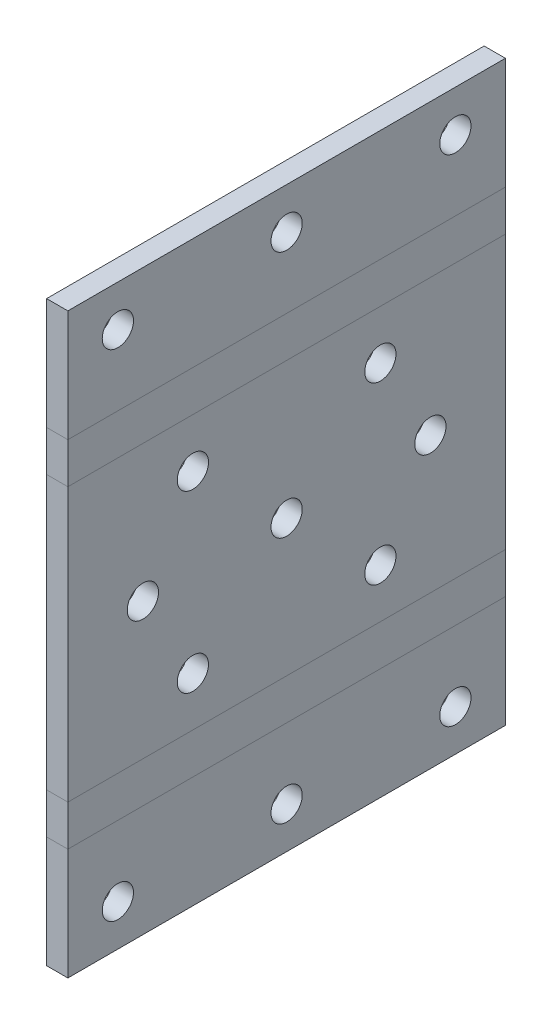
from build123d import *

# Parameters (mm, degrees)
SKETCH11_W                     = 3.4
SKETCH11_H                     = 52
BASE_FLANGE3_DEPTH             = 70
EDGE_FLANGE1_STRIP_W           = 15.1
EDGE_FLANGE1_STRIP_H           = 3.4
EDGE_FLANGE1_STRIP_CUT_DEPTH   = 70
EDGE_FLANGE1_STRIP_2_W         = 15.1
EDGE_FLANGE1_STRIP_2_H         = 3.4
EDGE_FLANGE1_STRIP_CUT_2_DEPTH = 70
EDGE_FLANGE1_DEPTH             = 70
EDGE_FLANGE1_BEND_DEPTH        = 70
CUT_EXTRUDE1_DEPTH             = 89.011135659
CUT_EXTRUDE1_DEPTH_BACK        = 89.011135659
SKETCH25_R                     = 2.5
SKETCH23_R                     = 2.5
CUT_EXTRUDE2_DEPTH             = 77.954272136
UNFOLD1_START                  = -22
UNFOLD1_OUTLINE_W              = 4.15
UNFOLD1_OUTLINE_H              = 70
UNFOLD1_DEPTH                  = 18.6
UNFOLD1_START_2                = -3.4
UNFOLD1_2_OUTLINE_W            = 24.368804756
UNFOLD1_2_OUTLINE_H            = 70
UNFOLD1_2_OUTLINE_R            = 2.5
UNFOLD1_2_DEPTH                = 3.4


with BuildPart() as part:
    # Base-Flange3: sheet metal written as solids
    # Sketch11 → Base-Flange3 (new body)
    with BuildSketch(Plane.XY):
        with Locations((-1.7, 0)):
            Rectangle(SKETCH11_W, SKETCH11_H)
    extrude(amount=BASE_FLANGE3_DEPTH)

    # Edge-Flange1: sheet metal written as solids
    # Edge-Flange1 strip (on a plane across the edge) → Edge-Flange1 strip cut (cut)
    with BuildSketch(Plane(origin=(-3.4, 26, 70), x_dir=(0, -1, 0), z_dir=(0, 0, -1))):
        with Locations((-3.4, -1.7)):
            Rectangle(EDGE_FLANGE1_STRIP_W, EDGE_FLANGE1_STRIP_H)
    extrude(amount=EDGE_FLANGE1_STRIP_CUT_DEPTH, mode=Mode.SUBTRACT)

    # Edge-Flange1 strip 2 (on a plane across the edge) → Edge-Flange1 strip cut 2 (cut)
    with BuildSketch(Plane(origin=(-3.4, -26, 0), x_dir=(0, 1, 0), z_dir=(0, 0, 1))):
        with Locations((-3.4, -1.7)):
            Rectangle(EDGE_FLANGE1_STRIP_2_W, EDGE_FLANGE1_STRIP_2_H)
    extrude(amount=EDGE_FLANGE1_STRIP_CUT_2_DEPTH, mode=Mode.SUBTRACT)

    # Edge-Flange1 section (on a plane across the edge) → Edge-Flange1 (add)
    with BuildSketch(Plane(origin=(-3.4, 26, 70), x_dir=(0, -1, 0), z_dir=(0, 0, -1))):
        with BuildLine():
            Line((0, 0.75), (0, 18.6))
            Line((0, 18.6), (3.4, 18.6))
            Line((3.4, 18.6), (3.4, 0.75))
            ThreePointArc((3.4, 0.75), (3.619669914, 0.219669914), (4.15, 0))
            Line((4.15, 0), (4.15, -3.4))
            ThreePointArc((4.15, -3.4), (1.215506858, -2.184493142), (0, 0.75))
        make_face()
    extrude(amount=EDGE_FLANGE1_DEPTH)

    # Edge-Flange1 section 2 (on a plane across the edge) → Edge-Flange1 bend (add)
    with BuildSketch(Plane(origin=(-3.4, -26, 0), x_dir=(0, 1, 0), z_dir=(0, 0, 1))):
        with BuildLine():
            Line((0, 0.75), (0, 18.6))
            Line((0, 18.6), (3.4, 18.6))
            Line((3.4, 18.6), (3.4, 0.75))
            ThreePointArc((3.4, 0.75), (3.619669914, 0.219669914), (4.15, 0))
            Line((4.15, 0), (4.15, -3.4))
            ThreePointArc((4.15, -3.4), (1.215506858, -2.184493142), (0, 0.75))
        make_face()
    extrude(amount=EDGE_FLANGE1_BEND_DEPTH)

    # Sketch25 → Cut-Extrude1 (cut, two sides: drawn at the far end of the back side and taken through both)
    with BuildSketch(Plane.XZ.offset(-22.6).offset(-CUT_EXTRUDE1_DEPTH_BACK)):
        with Locations((-15.4, 35)):
            Circle(SKETCH25_R)
        with Locations((-15.4, 8)):
            Circle(SKETCH25_R)
        with Locations(Location((-15.4, 62, 0), (0, 0, 180))):
            Circle(SKETCH25_R)
    extrude(amount=CUT_EXTRUDE1_DEPTH + CUT_EXTRUDE1_DEPTH_BACK, mode=Mode.SUBTRACT)

    # Sketch23 → Cut-Extrude2 (cut, through all)
    with BuildSketch(Plane.ZY.offset(3.4)):
        with Locations(Location((20, -14, 0), (0, 0, 270))):
            Circle(SKETCH23_R)
        with Locations(Location((50, -14, 0), (0, 0, 270))):
            Circle(SKETCH23_R)
        with Locations(Location((20, 14, 0), (0, 0, 90))):
            Circle(SKETCH23_R)
        with Locations(Location((50, 14, 0), (0, 0, 270))):
            Circle(SKETCH23_R)
        with Locations(Location((35, 0, 0), (0, 0, 270))):
            Circle(SKETCH23_R)
        with Locations(Location((58, 0, 0), (0, 0, 270))):
            Circle(SKETCH23_R)
        with Locations(Location((12, 0, 0), (0, 0, 90))):
            Circle(SKETCH23_R)
    extrude(amount=-CUT_EXTRUDE2_DEPTH, mode=Mode.SUBTRACT)

    # Unfold1: read off the stored shape, not the designer's step
    # Unfold1 outline → Unfold1 (cut)
    with BuildSketch(Plane.YZ.offset(UNFOLD1_START)):
        with Locations((-23.925, 35)):
            Rectangle(UNFOLD1_OUTLINE_W, UNFOLD1_OUTLINE_H)
        with Locations((23.925, 35)):
            Rectangle(UNFOLD1_OUTLINE_W, UNFOLD1_OUTLINE_H)
    extrude(amount=UNFOLD1_DEPTH, mode=Mode.SUBTRACT)

    # Unfold1 2 outline → Unfold1 2 (add)
    # profile 1 of 2: a face of its own
    with BuildSketch(Plane.YZ.offset(UNFOLD1_START_2)):
        with Locations((-34.034402378, 35)):
            Rectangle(UNFOLD1_2_OUTLINE_W, UNFOLD1_2_OUTLINE_H)
        with Locations((-39.618804756, 8)):
            Circle(UNFOLD1_2_OUTLINE_R, mode=Mode.SUBTRACT)
        with Locations((-39.618804756, 35)):
            Circle(UNFOLD1_2_OUTLINE_R, mode=Mode.SUBTRACT)
        with Locations((-39.618804756, 62)):
            Circle(UNFOLD1_2_OUTLINE_R, mode=Mode.SUBTRACT)
    # profile 2 of 2: a face of its own
    with BuildSketch(Plane.YZ.offset(UNFOLD1_START_2)):
        with Locations((34.034402378, 35)):
            Rectangle(UNFOLD1_2_OUTLINE_W, UNFOLD1_2_OUTLINE_H)
        with Locations((39.618804756, 8)):
            Circle(UNFOLD1_2_OUTLINE_R, mode=Mode.SUBTRACT)
        with Locations((39.618804756, 35)):
            Circle(UNFOLD1_2_OUTLINE_R, mode=Mode.SUBTRACT)
        with Locations((39.618804756, 62)):
            Circle(UNFOLD1_2_OUTLINE_R, mode=Mode.SUBTRACT)
    extrude(amount=UNFOLD1_2_DEPTH)


solid = part.part
